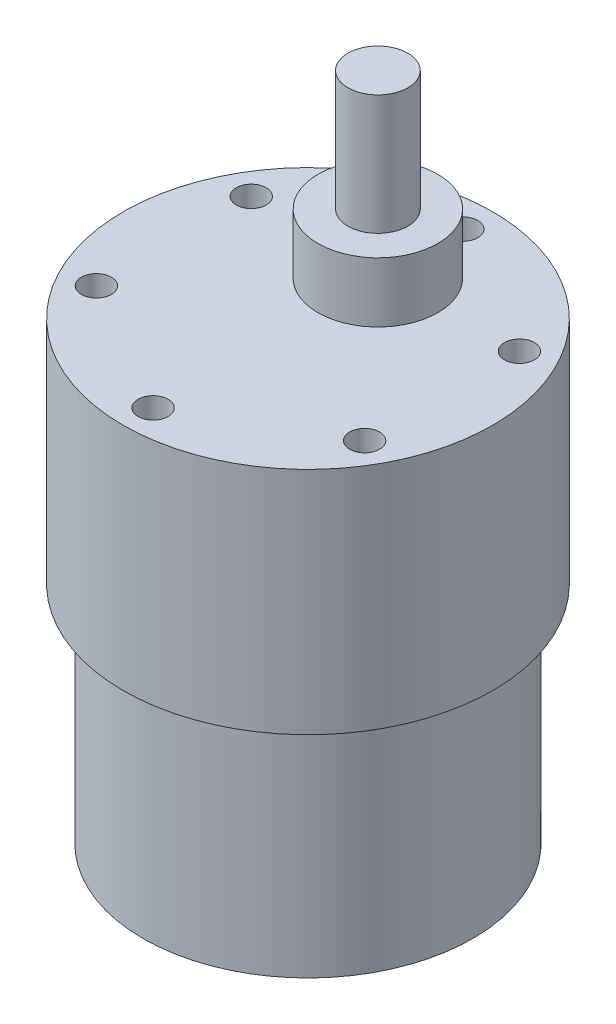
from build123d import *

# Parameters (mm, degrees)
SKETCH_1_R          = 18.5
EXTRUDE_1_DEPTH     = 23
SKETCH_3_R          = 16.5
EXTRUDE_2_DEPTH     = 22.5
SKETCH_4_R          = 1.5
CUT_EXTRUDE_1_DEPTH = 15
SKETCH_5_R          = 6
EXTRUDE_3_DEPTH     = 6
SKETCH_6_R          = 3
EXTRUDE_4_DEPTH     = 12


with BuildPart() as part:
    # 草图1 → 凸台-拉伸1 (new body)
    with BuildSketch(Plane(origin=(0, 0, 0), x_dir=(1, 0, 0), z_dir=(0, 1, 0))):
        Circle(SKETCH_1_R)
    extrude(amount=-EXTRUDE_1_DEPTH)

    # 草图3 → 凸台-拉伸2 (add)
    with BuildSketch(Plane.XZ.offset(23)):
        Circle(SKETCH_3_R)
    extrude(amount=EXTRUDE_2_DEPTH)

    # 草图4 → 切除-拉伸1 (cut)
    with BuildSketch(Plane(origin=(0, 0, 0), x_dir=(1, 0, 0), z_dir=(0, 1, 0))):
        with Locations((0, 15.5)):
            Circle(SKETCH_4_R)
        with Locations((13.423393759, 7.75)):
            Circle(SKETCH_4_R)
        with Locations((13.423393759, -7.75)):
            Circle(SKETCH_4_R)
        with Locations((0, -15.5)):
            Circle(SKETCH_4_R)
        with Locations((-13.423393759, -7.75)):
            Circle(SKETCH_4_R)
        with Locations((-13.423393759, 7.75)):
            Circle(SKETCH_4_R)
    extrude(amount=-CUT_EXTRUDE_1_DEPTH, mode=Mode.SUBTRACT)

    # 草图5 → 凸台-拉伸3 (add)
    with BuildSketch(Plane(origin=(0, 0, 0), x_dir=(1, 0, 0), z_dir=(0, 1, 0))):
        with Locations((0, 7)):
            Circle(SKETCH_5_R)
    extrude(amount=EXTRUDE_3_DEPTH)

    # 草图6 → 凸台-拉伸4 (add)
    with BuildSketch(Plane(origin=(0, 6, 0), x_dir=(1, 0, 0), z_dir=(0, 1, 0))):
        with Locations((0, 7)):
            Circle(SKETCH_6_R)
    extrude(amount=EXTRUDE_4_DEPTH)


solid = part.part
